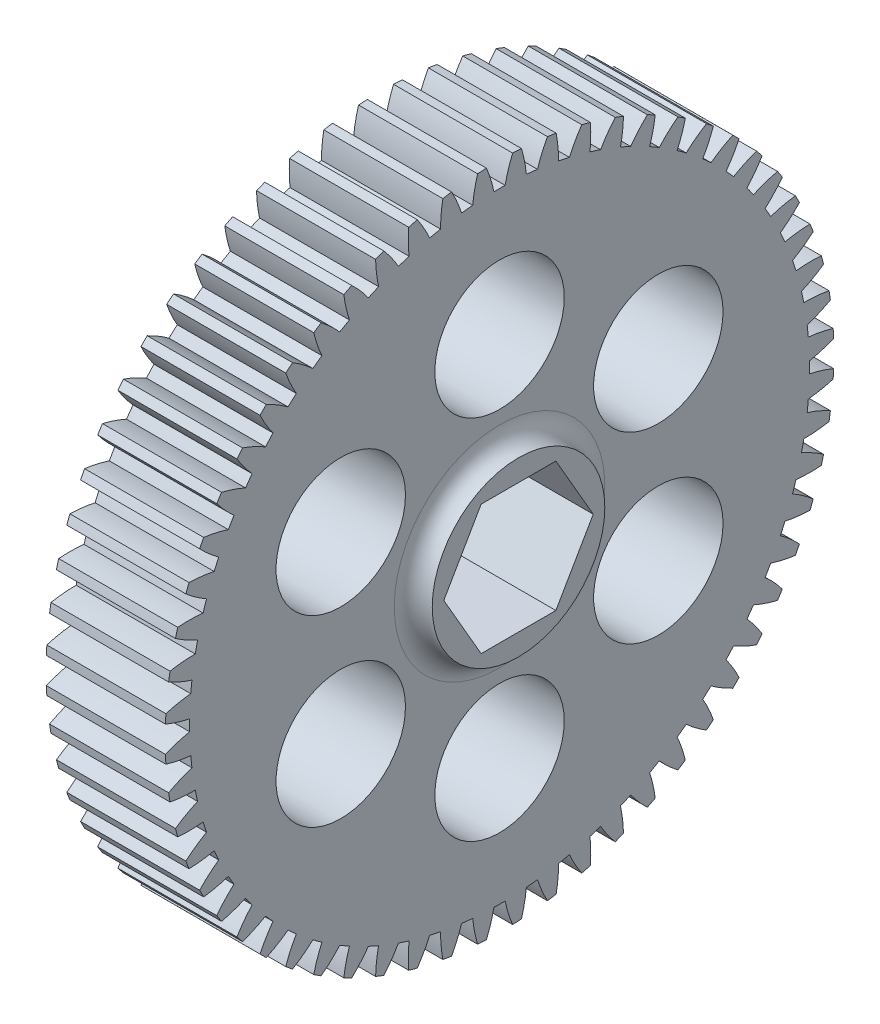
from build123d import *

# Parameters (mm, degrees)
SPUR_START             = -49.980883622
SPUR_GEAR_AI_OUTLINE_R = 4.7625
SPUR_GEAR_AI_DEPTH     = 8.763
SKETCH1_R              = 6.35
BOSS_EXTRUDE1_DEPTH    = 1.397
CUT_EXTRUDE1_DEPTH     = 58.012973395
SKETCH3_R              = 4.7625
CUT_EXTRUDE2_DEPTH     = 57.780663213
FILLET1_R              = 1.397


# Read off the part's stored shape, not the designer's step: spur gear_ai
with BuildPart() as part:
    # spur gear_ai outline → spur gear_ai (new body)
    with BuildSketch(Plane.YZ.offset(SPUR_START)):
        with BuildLine():
            ThreePointArc((27.963498005, 19.681787588), (28.016436653, 20.002319527), (28.065138823, 20.323522458))
            ThreePointArc((28.065138823, 20.323522458), (27.225914699, 20.732934522), (26.350635604, 21.058206522))
            ThreePointArc((26.350635604, 21.058206522), (26.397379238, 21.467374458), (26.436727862, 21.87731964))
            ThreePointArc((26.436727862, 21.87731964), (27.36050786, 22.01350291), (28.266514478, 22.239483832))
            ThreePointArc((28.266514478, 22.239483832), (28.285658411, 22.563793459), (28.300518938, 22.88832757))
            ThreePointArc((28.300518938, 22.88832757), (27.423096957, 23.207774024), (26.51861255, 23.439772571))
            ThreePointArc((26.51861255, 23.439772571), (26.522330422, 23.851585082), (26.51861255, 24.263397593))
            ThreePointArc((26.51861255, 24.263397593), (27.423096958, 24.49539614), (28.300518938, 24.814842595))
            ThreePointArc((28.300518938, 24.814842595), (28.285658411, 25.139376706), (28.266514478, 25.463686333))
            ThreePointArc((28.266514478, 25.463686333), (27.36050786, 25.689667255), (26.436727862, 25.825850524))
            ThreePointArc((26.436727862, 25.825850524), (26.397379238, 26.235795706), (26.350635604, 26.644963642))
            ThreePointArc((26.350635604, 26.644963642), (27.225914699, 26.970235642), (28.065138823, 27.379647706))
            ThreePointArc((28.065138823, 27.379647706), (28.016436653, 27.700850638), (27.963498005, 28.021382577))
            ThreePointArc((27.963498005, 28.021382577), (27.038833147, 28.151422072), (26.105878684, 28.190298012))
            ThreePointArc((26.105878684, 28.190298012), (26.023894676, 28.59388442), (25.934637414, 28.995924851))
            ThreePointArc((25.934637414, 28.995924851), (26.771121456, 29.410906556), (27.562953009, 29.905798626))
            ThreePointArc((27.562953009, 29.905798626), (27.480942785, 30.220151211), (27.39478943, 30.533393647))
            ThreePointArc((27.39478943, 30.533393647), (26.461597154, 30.566066976), (25.529689871, 30.507209653))
            ThreePointArc((25.529689871, 30.507209653), (25.405968713, 30.90001551), (25.275175743, 31.290523597))
            ThreePointArc((25.275175743, 31.290523597), (26.063700038, 31.79066838), (26.799463547, 32.365618315))
            ThreePointArc((26.799463547, 32.365618315), (26.685043791, 32.669676441), (26.566619643, 32.972197424))
            ThreePointArc((26.566619643, 32.972197424), (25.6351242, 32.907146611), (24.714474268, 32.751200878))
            ThreePointArc((24.714474268, 32.751200878), (24.550371474, 33.128922521), (24.379475791, 33.503619776))
            ThreePointArc((24.379475791, 33.503619776), (25.111401103, 34.083447946), (25.783035389, 34.732156474))
            ThreePointArc((25.783035389, 34.732156474), (25.637459708, 35.022588816), (25.488062245, 35.311073864))
            ThreePointArc((25.488062245, 35.311073864), (24.568469293, 35.149011618), (23.669163546, 34.89768605))
            ThreePointArc((23.669163546, 34.89768605), (23.466477062, 35.256185082), (23.257351035, 35.610966242))
            ThreePointArc((23.257351035, 35.610966242), (23.924658235, 36.264125081), (24.524804733, 36.979484816))
            ThreePointArc((24.524804733, 36.979484816), (24.349668084, 37.253109338), (24.170934138, 37.524397747))
            ThreePointArc((24.170934138, 37.524397747), (23.27331893, 37.267099657), (22.405210349, 36.923147829))
            ThreePointArc((22.405210349, 36.923147829), (22.16616085, 37.258496459), (21.921095708, 37.589474468))
            ThreePointArc((21.921095708, 37.589474468), (22.51647364, 38.308807831), (23.038557018, 39.082981142))
            ThreePointArc((23.038557018, 39.082981142), (22.835778236, 39.336799955), (22.629666053, 39.587919433))
            ThreePointArc((22.629666053, 39.587919433), (21.763863049, 39.23820451), (20.936462813, 38.80539483))
            ThreePointArc((20.936462813, 38.80539483), (20.663669375, 39.113918909), (20.385350103, 39.417467504))
            ThreePointArc((20.385350103, 39.417467504), (20.902275681, 40.195094224), (21.340575886, 41.019599105))
            ThreePointArc((21.340575886, 41.019599105), (21.112376656, 41.250831317), (20.881144444, 41.479030546))
            ThreePointArc((20.881144444, 41.479030546), (20.056639562, 41.040730342), (19.279012843, 40.523804763))
            ThreePointArc((19.279012843, 40.523804763), (18.975464249, 40.802124035), (18.66694017, 41.074917473))
            ThreePointArc((18.66694017, 41.074917473), (19.09974985, 41.902317709), (19.449464772, 42.768120713))
            ThreePointArc((19.449464772, 42.768120713), (19.198345294, 42.974232896), (18.944526481, 43.177011679))
            ThreePointArc((18.944526481, 43.177011679), (18.170353171, 42.6549283), (17.451019808, 42.059550368))
            ThreePointArc((17.451019808, 42.059550368), (17.120041798, 42.30461551), (16.784693168, 42.543665009))
            ThreePointArc((16.784693168, 42.543665009), (17.128644996, 43.411773591), (17.385943086, 44.309388799))
            ThreePointArc((17.385943086, 44.309388799), (17.114654677, 44.488122745), (16.841030156, 44.663259393))
            ThreePointArc((16.841030156, 44.663259393), (16.125670421, 44.063112896), (15.472511582, 43.395805695))
            ThreePointArc((15.472511582, 43.395805695), (15.117730422, 43.604931722), (14.75923139, 43.807618206))
            ThreePointArc((14.75923139, 43.807618206), (15.010556958, 44.706923954), (15.172619204, 45.626516906))
            ThreePointArc((15.172619204, 45.626516906), (14.884134156, 45.775914368), (14.593701814, 45.921490049))
            ThreePointArc((14.593701814, 45.921490049), (13.944993286, 45.249855763), (13.365165115, 44.517930451))
            ThreePointArc((13.365165115, 44.517930451), (12.990467861, 44.688826135), (12.612746218, 44.852928928))
            ThreePointArc((12.612746218, 44.852928928), (12.76869195, 45.77357886), (12.833742764, 46.705074303))
            ThreePointArc((12.833742764, 46.705074303), (12.53122178, 46.823498452), (12.227163654, 46.937918208))
            ThreePointArc((12.227163654, 46.937918208), (11.652213719, 46.202154699), (11.152068936, 45.413630403))
            ThreePointArc((11.152068936, 45.413630403), (10.76156085, 45.544423374), (10.368754992, 45.668144532))
            ThreePointArc((10.368754992, 45.668144532), (10.427612315, 46.600051815), (10.394938986, 47.53324409))
            ThreePointArc((10.394938986, 47.53324409), (10.08169655, 47.619397445), (9.767343965, 47.701407669))
            ThreePointArc((9.767343965, 47.701407669), (9.272451895, 46.909576117), (8.857470191, 46.073092074))
            ThreePointArc((8.857470191, 46.073092074), (8.45542976, 46.162349337), (8.051843351, 46.244333345))
            ThreePointArc((8.051843351, 46.244333345), (8.012967412, 47.177287808), (7.882927916, 48.101952665))
            ThreePointArc((7.882927916, 48.101952665), (7.562395977, 48.154891313), (7.241193046, 48.203593484))
            ThreePointArc((7.241193046, 48.203593484), (6.831780982, 47.36436936), (6.506508982, 46.489090264))
            ThreePointArc((6.506508982, 46.489090264), (6.097341046, 46.535833898), (5.687395864, 46.575182522))
            ThreePointArc((5.687395864, 46.575182522), (5.551212594, 47.498962521), (5.325231672, 48.404969139))
            ThreePointArc((5.325231672, 48.404969139), (5.000922045, 48.424113072), (4.676387934, 48.438973598))
            ThreePointArc((4.676387934, 48.438973598), (4.35694148, 47.561551617), (4.124942933, 46.65706721))
            ThreePointArc((4.124942933, 46.65706721), (3.713130422, 46.660785082), (3.301317911, 46.65706721))
            ThreePointArc((3.301317911, 46.65706721), (3.069319364, 47.561551618), (2.749872909, 48.438973598))
            ThreePointArc((2.749872909, 48.438973598), (2.425338798, 48.424113072), (2.101029171, 48.404969139))
            ThreePointArc((2.101029171, 48.404969139), (1.875048249, 47.498962521), (1.73886498, 46.575182522))
            ThreePointArc((1.73886498, 46.575182522), (1.328919798, 46.535833898), (0.919751862, 46.489090264))
            ThreePointArc((0.919751862, 46.489090264), (0.594479862, 47.36436936), (0.185067798, 48.203593484))
            ThreePointArc((0.185067798, 48.203593484), (-0.136135134, 48.154891313), (-0.456667073, 48.101952665))
            ThreePointArc((-0.456667073, 48.101952665), (-0.586706568, 47.177287808), (-0.625582508, 46.244333345))
            ThreePointArc((-0.625582508, 46.244333345), (-1.029168917, 46.162349337), (-1.431209347, 46.073092074))
            ThreePointArc((-1.431209347, 46.073092074), (-1.846191052, 46.909576117), (-2.341083122, 47.701407669))
            ThreePointArc((-2.341083122, 47.701407669), (-2.655435707, 47.619397445), (-2.968678143, 47.53324409))
            ThreePointArc((-2.968678143, 47.53324409), (-3.001351472, 46.600051815), (-2.942494149, 45.668144532))
            ThreePointArc((-2.942494149, 45.668144532), (-3.335300007, 45.544423374), (-3.725808093, 45.413630403))
            ThreePointArc((-3.725808093, 45.413630403), (-4.225952876, 46.202154699), (-4.800902811, 46.937918208))
            ThreePointArc((-4.800902811, 46.937918208), (-5.104960937, 46.823498452), (-5.40748192, 46.705074303))
            ThreePointArc((-5.40748192, 46.705074303), (-5.342431107, 45.77357886), (-5.186485374, 44.852928928))
            ThreePointArc((-5.186485374, 44.852928928), (-5.564207018, 44.688826135), (-5.938904272, 44.517930451))
            ThreePointArc((-5.938904272, 44.517930451), (-6.518732442, 45.249855763), (-7.16744097, 45.921490049))
            ThreePointArc((-7.16744097, 45.921490049), (-7.457873312, 45.775914368), (-7.74635836, 45.626516906))
            ThreePointArc((-7.74635836, 45.626516906), (-7.584296114, 44.706923954), (-7.332970546, 43.807618206))
            ThreePointArc((-7.332970546, 43.807618206), (-7.691469578, 43.604931722), (-8.046250738, 43.395805695))
            ThreePointArc((-8.046250738, 43.395805695), (-8.699409577, 44.063112896), (-9.414769312, 44.663259393))
            ThreePointArc((-9.414769312, 44.663259393), (-9.688393834, 44.488122745), (-9.959682243, 44.309388799))
            ThreePointArc((-9.959682243, 44.309388799), (-9.702384153, 43.411773591), (-9.358432325, 42.543665009))
            ThreePointArc((-9.358432325, 42.543665009), (-9.693780955, 42.30461551), (-10.024758964, 42.059550368))
            ThreePointArc((-10.024758964, 42.059550368), (-10.744092327, 42.6549283), (-11.518265638, 43.177011679))
            ThreePointArc((-11.518265638, 43.177011679), (-11.77208445, 42.974232896), (-12.023203929, 42.768120713))
            ThreePointArc((-12.023203929, 42.768120713), (-11.673489006, 41.902317709), (-11.240679326, 41.074917473))
            ThreePointArc((-11.240679326, 41.074917473), (-11.549203405, 40.802124036), (-11.852752, 40.523804763))
            ThreePointArc((-11.852752, 40.523804763), (-12.630378719, 41.040730342), (-13.4548836, 41.479030546))
            ThreePointArc((-13.4548836, 41.479030546), (-13.686115813, 41.250831317), (-13.914315042, 41.019599105))
            ThreePointArc((-13.914315042, 41.019599105), (-13.476014838, 40.195094223), (-12.959089259, 39.417467504))
            ThreePointArc((-12.959089259, 39.417467504), (-13.237408531, 39.113918909), (-13.510201969, 38.80539483))
            ThreePointArc((-13.510201969, 38.80539483), (-14.337602205, 39.23820451), (-15.203405209, 39.587919433))
            ThreePointArc((-15.203405209, 39.587919433), (-15.409517392, 39.336799955), (-15.612296175, 39.082981142))
            ThreePointArc((-15.612296175, 39.082981142), (-15.090212796, 38.308807831), (-14.494834864, 37.589474468))
            ThreePointArc((-14.494834864, 37.589474468), (-14.739900006, 37.258496459), (-14.978949505, 36.923147829))
            ThreePointArc((-14.978949505, 36.923147829), (-15.847058087, 37.267099657), (-16.744673295, 37.524397747))
            ThreePointArc((-16.744673295, 37.524397747), (-16.923407241, 37.253109338), (-17.098543889, 36.979484816))
            ThreePointArc((-17.098543889, 36.979484816), (-16.498397392, 36.264125081), (-15.831090191, 35.610966242))
            ThreePointArc((-15.831090191, 35.610966242), (-16.040216218, 35.256185082), (-16.242902702, 34.89768605))
            ThreePointArc((-16.242902702, 34.89768605), (-17.14220845, 35.149011618), (-18.061801402, 35.311073864))
            ThreePointArc((-18.061801402, 35.311073864), (-18.211198864, 35.022588816), (-18.356774545, 34.732156474))
            ThreePointArc((-18.356774545, 34.732156474), (-17.685140259, 34.083447946), (-16.953214947, 33.503619776))
            ThreePointArc((-16.953214947, 33.503619776), (-17.124110631, 33.128922522), (-17.288213424, 32.751200878))
            ThreePointArc((-17.288213424, 32.751200878), (-18.208863356, 32.907146611), (-19.140358799, 32.972197424))
            ThreePointArc((-19.140358799, 32.972197424), (-19.258782948, 32.669676441), (-19.373202704, 32.365618315))
            ThreePointArc((-19.373202704, 32.365618315), (-18.637439195, 31.79066838), (-17.848914899, 31.290523597))
            ThreePointArc((-17.848914899, 31.290523597), (-17.97970787, 30.900015511), (-18.103429028, 30.507209653))
            ThreePointArc((-18.103429028, 30.507209653), (-19.035336311, 30.566066976), (-19.968528586, 30.533393647))
            ThreePointArc((-19.968528586, 30.533393647), (-20.054681941, 30.220151211), (-20.136692165, 29.905798626))
            ThreePointArc((-20.136692165, 29.905798626), (-19.344860613, 29.410906556), (-18.50837657, 28.995924851))
            ThreePointArc((-18.50837657, 28.995924851), (-18.597633833, 28.593884421), (-18.679617841, 28.190298012))
            ThreePointArc((-18.679617841, 28.190298012), (-19.612572304, 28.151422072), (-20.537237161, 28.021382577))
            ThreePointArc((-20.537237161, 28.021382577), (-20.590175809, 27.700850638), (-20.63887798, 27.379647706))
            ThreePointArc((-20.63887798, 27.379647706), (-19.799653856, 26.970235642), (-18.92437476, 26.644963642))
            ThreePointArc((-18.92437476, 26.644963642), (-18.971118394, 26.235795706), (-19.010467018, 25.825850524))
            ThreePointArc((-19.010467018, 25.825850524), (-19.934247017, 25.689667255), (-20.840253635, 25.463686333))
            ThreePointArc((-20.840253635, 25.463686333), (-20.859397568, 25.139376706), (-20.874258094, 24.814842595))
            ThreePointArc((-20.874258094, 24.814842595), (-19.996836114, 24.49539614), (-19.092351706, 24.263397593))
            ThreePointArc((-19.092351706, 24.263397593), (-19.096069578, 23.851585082), (-19.092351706, 23.439772571))
            ThreePointArc((-19.092351706, 23.439772571), (-19.996836113, 23.207774024), (-20.874258094, 22.88832757))
            ThreePointArc((-20.874258094, 22.88832757), (-20.859397568, 22.563793459), (-20.840253635, 22.239483832))
            ThreePointArc((-20.840253635, 22.239483832), (-19.934247017, 22.01350291), (-19.010467018, 21.87731964))
            ThreePointArc((-19.010467018, 21.87731964), (-18.971118394, 21.467374458), (-18.92437476, 21.058206522))
            ThreePointArc((-18.92437476, 21.058206522), (-19.799653856, 20.732934522), (-20.63887798, 20.323522458))
            ThreePointArc((-20.63887798, 20.323522458), (-20.590175809, 20.002319527), (-20.537237161, 19.681787588))
            ThreePointArc((-20.537237161, 19.681787588), (-19.612572304, 19.551748092), (-18.679617841, 19.512872153))
            ThreePointArc((-18.679617841, 19.512872153), (-18.597633833, 19.109285744), (-18.50837657, 18.707245314))
            ThreePointArc((-18.50837657, 18.707245314), (-19.344860613, 18.292263609), (-20.136692165, 17.797371539))
            ThreePointArc((-20.136692165, 17.797371539), (-20.054681941, 17.483018954), (-19.968528586, 17.169776518))
            ThreePointArc((-19.968528586, 17.169776518), (-19.035336311, 17.137103189), (-18.103429028, 17.195960512))
            ThreePointArc((-18.103429028, 17.195960512), (-17.97970787, 16.803154654), (-17.848914899, 16.412646568))
            ThreePointArc((-17.848914899, 16.412646568), (-18.637439195, 15.912501785), (-19.373202704, 15.33755185))
            ThreePointArc((-19.373202704, 15.33755185), (-19.258782948, 15.033493724), (-19.140358799, 14.73097274))
            ThreePointArc((-19.140358799, 14.73097274), (-18.208863356, 14.796023554), (-17.288213424, 14.951969287))
            ThreePointArc((-17.288213424, 14.951969287), (-17.124110631, 14.574247643), (-16.953214947, 14.199550389))
            ThreePointArc((-16.953214947, 14.199550389), (-17.685140259, 13.619722219), (-18.356774545, 12.97101369))
            ThreePointArc((-18.356774545, 12.97101369), (-18.211198864, 12.680581348), (-18.061801402, 12.3920963))
            ThreePointArc((-18.061801402, 12.3920963), (-17.14220845, 12.554158546), (-16.242902702, 12.805484114))
            ThreePointArc((-16.242902702, 12.805484114), (-16.040216218, 12.446985082), (-15.831090191, 12.092203922))
            ThreePointArc((-15.831090191, 12.092203922), (-16.498397392, 11.439045083), (-17.098543889, 10.723685348))
            ThreePointArc((-17.098543889, 10.723685348), (-16.923407241, 10.450060827), (-16.744673295, 10.178772418))
            ThreePointArc((-16.744673295, 10.178772418), (-15.847058087, 10.436070508), (-14.978949505, 10.780022336))
            ThreePointArc((-14.978949505, 10.780022336), (-14.739900006, 10.444673706), (-14.494834864, 10.113695696))
            ThreePointArc((-14.494834864, 10.113695696), (-15.090212796, 9.394362333), (-15.612296175, 8.620189023))
            ThreePointArc((-15.612296175, 8.620189023), (-15.409517392, 8.36637021), (-15.203405209, 8.115250732))
            ThreePointArc((-15.203405209, 8.115250732), (-14.337602205, 8.464965654), (-13.510201969, 8.897775334))
            ThreePointArc((-13.510201969, 8.897775334), (-13.237408531, 8.589251256), (-12.959089259, 8.285702661))
            ThreePointArc((-12.959089259, 8.285702661), (-13.476014838, 7.508075942), (-13.914315042, 6.68357106))
            ThreePointArc((-13.914315042, 6.68357106), (-13.686115813, 6.452338847), (-13.4548836, 6.224139618))
            ThreePointArc((-13.4548836, 6.224139618), (-12.630378719, 6.662439823), (-11.852752, 7.179365401))
            ThreePointArc((-11.852752, 7.179365401), (-11.549203405, 6.901046129), (-11.240679326, 6.628252691))
            ThreePointArc((-11.240679326, 6.628252691), (-11.673489006, 5.800852455), (-12.023203929, 4.935049451))
            ThreePointArc((-12.023203929, 4.935049451), (-11.772084451, 4.728937268), (-11.518265638, 4.526158486))
            ThreePointArc((-11.518265638, 4.526158486), (-10.744092327, 5.048241864), (-10.024758964, 5.643619796))
            ThreePointArc((-10.024758964, 5.643619796), (-9.693780955, 5.398554654), (-9.358432325, 5.159505155))
            ThreePointArc((-9.358432325, 5.159505155), (-9.702384153, 4.291396574), (-9.959682243, 3.393781366))
            ThreePointArc((-9.959682243, 3.393781366), (-9.688393834, 3.21504742), (-9.414769312, 3.039910771))
            ThreePointArc((-9.414769312, 3.039910771), (-8.699409577, 3.640057269), (-8.046250738, 4.307364469))
            ThreePointArc((-8.046250738, 4.307364469), (-7.691469578, 4.098238442), (-7.332970546, 3.895551958))
            ThreePointArc((-7.332970546, 3.895551958), (-7.584296114, 2.996246211), (-7.74635836, 2.076653259))
            ThreePointArc((-7.74635836, 2.076653259), (-7.457873312, 1.927255796), (-7.16744097, 1.781680115))
            ThreePointArc((-7.16744097, 1.781680115), (-6.518732442, 2.453314402), (-5.938904272, 3.185239713))
            ThreePointArc((-5.938904272, 3.185239713), (-5.564207017, 3.01434403), (-5.186485374, 2.850241236))
            ThreePointArc((-5.186485374, 2.850241236), (-5.342431107, 1.929591304), (-5.40748192, 0.998095861))
            ThreePointArc((-5.40748192, 0.998095861), (-5.104960937, 0.879671713), (-4.800902811, 0.765251957))
            ThreePointArc((-4.800902811, 0.765251957), (-4.225952876, 1.501015466), (-3.725808093, 2.289539761))
            ThreePointArc((-3.725808093, 2.289539761), (-3.335300006, 2.158746791), (-2.942494149, 2.035025633))
            ThreePointArc((-2.942494149, 2.035025633), (-3.001351472, 1.10311835), (-2.968678143, 0.169926074))
            ThreePointArc((-2.968678143, 0.169926074), (-2.655435707, 0.083772719), (-2.341083122, 0.001762495))
            ThreePointArc((-2.341083122, 0.001762495), (-1.846191052, 0.793594048), (-1.431209347, 1.630078091))
            ThreePointArc((-1.431209347, 1.630078091), (-1.029168917, 1.540820828), (-0.625582508, 1.45883682))
            ThreePointArc((-0.625582508, 1.45883682), (-0.586706568, 0.525882357), (-0.456667073, -0.398782501))
            ThreePointArc((-0.456667073, -0.398782501), (-0.136135134, -0.451721149), (0.185067798, -0.500423319))
            ThreePointArc((0.185067798, -0.500423319), (0.594479862, 0.338800805), (0.919751862, 1.2140799))
            ThreePointArc((0.919751862, 1.2140799), (1.328919798, 1.167336266), (1.73886498, 1.127987642))
            ThreePointArc((1.73886498, 1.127987642), (1.875048249, 0.204207644), (2.101029171, -0.701798974))
            ThreePointArc((2.101029171, -0.701798974), (2.425338798, -0.720942907), (2.749872909, -0.735803434))
            ThreePointArc((2.749872909, -0.735803434), (3.069319364, 0.141618546), (3.301317911, 1.046102954))
            ThreePointArc((3.301317911, 1.046102954), (3.713130422, 1.042385082), (4.124942933, 1.046102954))
            ThreePointArc((4.124942933, 1.046102954), (4.35694148, 0.141618547), (4.676387934, -0.735803434))
            ThreePointArc((4.676387934, -0.735803434), (5.000922045, -0.720942907), (5.325231672, -0.701798974))
            ThreePointArc((5.325231672, -0.701798974), (5.551212594, 0.204207644), (5.687395864, 1.127987642))
            ThreePointArc((5.687395864, 1.127987642), (6.097341046, 1.167336266), (6.506508982, 1.2140799))
            ThreePointArc((6.506508982, 1.2140799), (6.831780982, 0.338800805), (7.241193046, -0.500423319))
            ThreePointArc((7.241193046, -0.500423319), (7.562395977, -0.451721149), (7.882927916, -0.398782501))
            ThreePointArc((7.882927916, -0.398782501), (8.012967412, 0.525882357), (8.051843351, 1.45883682))
            ThreePointArc((8.051843351, 1.45883682), (8.45542976, 1.540820828), (8.857470191, 1.630078091))
            ThreePointArc((8.857470191, 1.630078091), (9.272451895, 0.793594048), (9.767343965, 0.001762495))
            ThreePointArc((9.767343965, 0.001762495), (10.08169655, 0.083772719), (10.394938986, 0.169926074))
            ThreePointArc((10.394938986, 0.169926074), (10.427612315, 1.10311835), (10.368754992, 2.035025633))
            ThreePointArc((10.368754992, 2.035025633), (10.76156085, 2.158746791), (11.152068936, 2.289539761))
            ThreePointArc((11.152068936, 2.289539761), (11.652213719, 1.501015466), (12.227163654, 0.765251957))
            ThreePointArc((12.227163654, 0.765251957), (12.53122178, 0.879671713), (12.833742764, 0.998095861))
            ThreePointArc((12.833742764, 0.998095861), (12.76869195, 1.929591304), (12.612746218, 2.850241236))
            ThreePointArc((12.612746218, 2.850241236), (12.990467861, 3.01434403), (13.365165115, 3.185239713))
            ThreePointArc((13.365165115, 3.185239713), (13.944993286, 2.453314402), (14.593701814, 1.781680115))
            ThreePointArc((14.593701814, 1.781680115), (14.884134156, 1.927255796), (15.172619204, 2.076653259))
            ThreePointArc((15.172619204, 2.076653259), (15.010556958, 2.996246211), (14.75923139, 3.895551958))
            ThreePointArc((14.75923139, 3.895551958), (15.117730422, 4.098238442), (15.472511582, 4.307364469))
            ThreePointArc((15.472511582, 4.307364469), (16.125670421, 3.640057269), (16.841030156, 3.039910771))
            ThreePointArc((16.841030156, 3.039910771), (17.114654677, 3.21504742), (17.385943086, 3.393781366))
            ThreePointArc((17.385943086, 3.393781366), (17.128644996, 4.291396574), (16.784693168, 5.159505155))
            ThreePointArc((16.784693168, 5.159505155), (17.120041798, 5.398554654), (17.451019808, 5.643619796))
            ThreePointArc((17.451019808, 5.643619796), (18.170353171, 5.048241864), (18.944526481, 4.526158486))
            ThreePointArc((18.944526481, 4.526158486), (19.198345294, 4.728937268), (19.449464772, 4.935049451))
            ThreePointArc((19.449464772, 4.935049451), (19.09974985, 5.800852455), (18.66694017, 6.628252691))
            ThreePointArc((18.66694017, 6.628252691), (18.975464248, 6.901046129), (19.279012843, 7.179365401))
            ThreePointArc((19.279012843, 7.179365401), (20.056639563, 6.662439823), (20.881144444, 6.224139618))
            ThreePointArc((20.881144444, 6.224139618), (21.112376656, 6.452338848), (21.340575886, 6.68357106))
            ThreePointArc((21.340575886, 6.68357106), (20.902275681, 7.508075941), (20.385350103, 8.285702661))
            ThreePointArc((20.385350103, 8.285702661), (20.663669375, 8.589251256), (20.936462813, 8.897775334))
            ThreePointArc((20.936462813, 8.897775334), (21.763863049, 8.464965654), (22.629666053, 8.115250732))
            ThreePointArc((22.629666053, 8.115250732), (22.835778236, 8.36637021), (23.038557018, 8.620189023))
            ThreePointArc((23.038557018, 8.620189023), (22.51647364, 9.394362333), (21.921095708, 10.113695696))
            ThreePointArc((21.921095708, 10.113695696), (22.16616085, 10.444673706), (22.405210349, 10.780022336))
            ThreePointArc((22.405210349, 10.780022336), (23.27331893, 10.436070508), (24.170934138, 10.178772418))
            ThreePointArc((24.170934138, 10.178772418), (24.349668084, 10.450060827), (24.524804733, 10.723685348))
            ThreePointArc((24.524804733, 10.723685348), (23.924658235, 11.439045083), (23.257351035, 12.092203922))
            ThreePointArc((23.257351035, 12.092203922), (23.466477062, 12.446985082), (23.669163546, 12.805484114))
            ThreePointArc((23.669163546, 12.805484114), (24.568469293, 12.554158546), (25.488062245, 12.3920963))
            ThreePointArc((25.488062245, 12.3920963), (25.637459708, 12.680581348), (25.783035389, 12.97101369))
            ThreePointArc((25.783035389, 12.97101369), (25.111401103, 13.619722219), (24.379475791, 14.199550389))
            ThreePointArc((24.379475791, 14.199550389), (24.550371474, 14.574247643), (24.714474268, 14.951969287))
            ThreePointArc((24.714474268, 14.951969287), (25.6351242, 14.796023554), (26.566619643, 14.73097274))
            ThreePointArc((26.566619643, 14.73097274), (26.685043791, 15.033493724), (26.799463547, 15.33755185))
            ThreePointArc((26.799463547, 15.33755185), (26.063700038, 15.912501785), (25.275175743, 16.412646568))
            ThreePointArc((25.275175743, 16.412646568), (25.405968713, 16.803154654), (25.529689871, 17.195960512))
            ThreePointArc((25.529689871, 17.195960512), (26.461597154, 17.137103189), (27.39478943, 17.169776518))
            ThreePointArc((27.39478943, 17.169776518), (27.480942785, 17.483018954), (27.562953009, 17.797371539))
            ThreePointArc((27.562953009, 17.797371539), (26.771121456, 18.292263609), (25.934637414, 18.707245314))
            ThreePointArc((25.934637414, 18.707245314), (26.023894676, 19.109285745), (26.105878684, 19.512872153))
            ThreePointArc((26.105878684, 19.512872153), (27.038833147, 19.551748092), (27.963498005, 19.681787588))
        make_face()
        with Locations((3.713130422, 23.851585082)):
            Circle(SPUR_GEAR_AI_OUTLINE_R, mode=Mode.SUBTRACT)
    extrude(amount=SPUR_GEAR_AI_DEPTH)

    # Sketch1 → Boss-Extrude1 (add)
    with BuildSketch(Plane(origin=(-41.217883622, 0, 0), x_dir=(0, 0, -1), z_dir=(1, 0, 0))):
        with Locations(Location((-23.851585082, 3.713130422, 0), (0, 0, 180))):
            Circle(SKETCH1_R)
    extrude(amount=BOSS_EXTRUDE1_DEPTH)

    # Sketch2 → Cut-Extrude1 (cut, through all)
    with BuildSketch(Plane(origin=(-39.820883622, 0, 0), x_dir=(0, 0, -1), z_dir=(1, 0, 0))):
        Polygon((-21.101954425, 8.475630422), (-26.601215739, 8.475630422), (-29.350846396, 3.713130422), (-26.601215739, -1.049369578), (-21.101954425, -1.049369578), (-18.352323768, 3.713130422), align=None)
    extrude(amount=-CUT_EXTRUDE1_DEPTH, mode=Mode.SUBTRACT)

    # Sketch3 → Cut-Extrude2 (cut, through all)
    with BuildSketch(Plane(origin=(-41.217883622, 0, 0), x_dir=(0, 0, -1), z_dir=(1, 0, 0))):
        with Locations((-23.851585082, 17.206880422)):
            Circle(SKETCH3_R)
        with Locations((-12.16565479, 10.460005422)):
            Circle(SKETCH3_R)
        with Locations((-12.16565479, -3.033744578)):
            Circle(SKETCH3_R)
        with Locations((-23.851585082, -9.780619578)):
            Circle(SKETCH3_R)
        with Locations((-35.537515375, -3.033744578)):
            Circle(SKETCH3_R)
        with Locations((-35.537515375, 10.460005422)):
            Circle(SKETCH3_R)
    extrude(amount=-CUT_EXTRUDE2_DEPTH, mode=Mode.SUBTRACT)

    # Fillet1
    fillet1_edges = [part.edges().sort_by_distance(p)[0] for p in [
        (-41.217883622, 3.713130422, 17.501585082),
    ]]
    fillet(fillet1_edges, radius=FILLET1_R - 0.0001)  # a hair under: the kernel refuses the full size


solid = part.part
